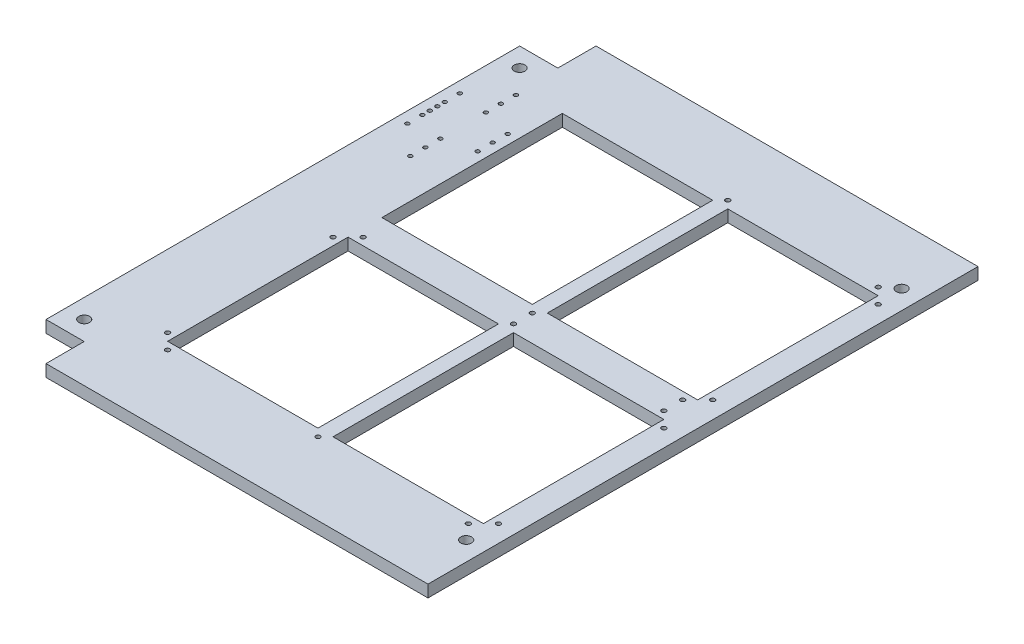
from build123d import *

# Parameters (mm, degrees)
BOSS_EXTRUDE1_DEPTH = 8
SKETCH2_R           = 3.57
CUT_EXTRUDE1_DEPTH  = 248.966140282
SKETCH3_R           = 1.3
CUT_EXTRUDE2_DEPTH  = 248.966140282
SKETCH5_W           = 100
SKETCH5_H           = 120
CUT_EXTRUDE3_DEPTH  = 248.966140282
SKETCH6_R           = 1.5
CUT_EXTRUDE4_DEPTH  = 248.966140282


with BuildPart() as part:
    # Sketch1 → Boss-Extrude1 (new body)
    with BuildSketch(Plane(origin=(0, 0, 0), x_dir=(1, 0, 0), z_dir=(0, 1, 0))):
        Polygon((113.643595506, 184.24988764), (-140.356404494, 184.24988764), (-140.356404494, 158.84988764), (-165.756404494, 158.84988764), (-165.756404494, -156.11011236), (-140.356404494, -156.11011236), (-140.356404494, -181.51011236), (113.643595506, -181.51011236), align=None)
    extrude(amount=BOSS_EXTRUDE1_DEPTH)

    # Sketch2 → Cut-Extrude1 (cut, through all)
    with BuildSketch(Plane(origin=(0, 8, 0), x_dir=(1, 0, 0), z_dir=(0, 1, 0))):
        with Locations((-153.056404494, -143.39011236)):
            Circle(SKETCH2_R)
        with Locations((100.943595506, 146.12988764)):
            Circle(SKETCH2_R)
        with Locations((100.943595506, -143.39011236)):
            Circle(SKETCH2_R)
        with Locations((-153.056404494, 146.12988764)):
            Circle(SKETCH2_R)
    extrude(amount=-CUT_EXTRUDE1_DEPTH, mode=Mode.SUBTRACT)

    # Sketch3 → Cut-Extrude2 (cut, through all)
    with BuildSketch(Plane(origin=(0, 8, 0), x_dir=(1, 0, 0), z_dir=(0, 1, 0))):
        with Locations((-158.405641044, 101.691092968)):
            Circle(SKETCH3_R)
        with Locations((-158.405641044, 91.691092968)):
            Circle(SKETCH3_R)
        with Locations((-158.405641044, 86.801092968)):
            Circle(SKETCH3_R)
        with Locations((-158.405641044, 76.801092968)):
            Circle(SKETCH3_R)
        with Locations((-138.748141044, 69.131092968)):
            Circle(SKETCH3_R)
        with Locations((-138.748141044, 59.131092968)):
            Circle(SKETCH3_R)
        with Locations((-119.090641044, 84.246092968)):
            Circle(SKETCH3_R)
        with Locations((-138.748141044, 109.361092968)):
            Circle(SKETCH3_R)
        with Locations((-119.090641044, 94.246092968)):
            Circle(SKETCH3_R)
        with Locations((-138.748141044, 119.361092968)):
            Circle(SKETCH3_R)
        with Locations((-158.405641044, 111.691092968)):
            Circle(SKETCH3_R)
        with Locations((-158.405641044, 96.801092968)):
            Circle(SKETCH3_R)
        with Locations((-138.748141044, 79.131092968)):
            Circle(SKETCH3_R)
        with Locations((-119.090641044, 104.246092968)):
            Circle(SKETCH3_R)
        with Locations((-138.748141044, 129.361092968)):
            Circle(SKETCH3_R)
    extrude(amount=-CUT_EXTRUDE2_DEPTH, mode=Mode.SUBTRACT)

    # Sketch5 → Cut-Extrude3 (cut, through all)
    with BuildSketch(Plane(origin=(0, 8, 0), x_dir=(1, 0, 0), z_dir=(0, 1, 0))):
        with Locations((-62.756404494, 74.24988764)):
            Rectangle(SKETCH5_W, SKETCH5_H)
        with Locations((-62.756404494, -68.25011236)):
            Rectangle(SKETCH5_W, SKETCH5_H)
        with Locations((47.243595506, 74.24988764)):
            Rectangle(SKETCH5_W, SKETCH5_H)
        with Locations((47.243595506, -68.25011236)):
            Rectangle(SKETCH5_W, SKETCH5_H)
    extrude(amount=-CUT_EXTRUDE3_DEPTH, mode=Mode.SUBTRACT)

    # Sketch6 → Cut-Extrude4 (cut, through all)
    with BuildSketch(Plane(origin=(0, 8, 0), x_dir=(1, 0, 0), z_dir=(0, 1, 0))):
        with Locations((-117.756404494, -123.25011236)):
            Circle(SKETCH6_R)
        with Locations((-7.756404494, -133.25011236)):
            Circle(SKETCH6_R)
        with Locations((-107.756404494, -133.25011236)):
            Circle(SKETCH6_R)
        with Locations((-107.756404494, -3.25011236)):
            Circle(SKETCH6_R)
        with Locations((-117.756404494, -13.25011236)):
            Circle(SKETCH6_R)
        with Locations((-7.756404494, -3.25011236)):
            Circle(SKETCH6_R)
        with Locations((-7.756404494, 9.24988764)):
            Circle(SKETCH6_R)
        with Locations((102.243595506, -13.25011236)):
            Circle(SKETCH6_R)
        with Locations((92.243595506, -3.25011236)):
            Circle(SKETCH6_R)
        with Locations((92.243595506, 9.24988764)):
            Circle(SKETCH6_R)
        with Locations((102.243595506, 19.24988764)):
            Circle(SKETCH6_R)
        with Locations((92.243595506, -133.25011236)):
            Circle(SKETCH6_R)
        with Locations((102.243595506, -123.25011236)):
            Circle(SKETCH6_R)
        with Locations((-7.756404494, 139.24988764)):
            Circle(SKETCH6_R)
        with Locations((92.243595506, 139.24988764)):
            Circle(SKETCH6_R)
        with Locations((102.243595506, 129.24988764)):
            Circle(SKETCH6_R)
    extrude(amount=-CUT_EXTRUDE4_DEPTH, mode=Mode.SUBTRACT)


solid = part.part
